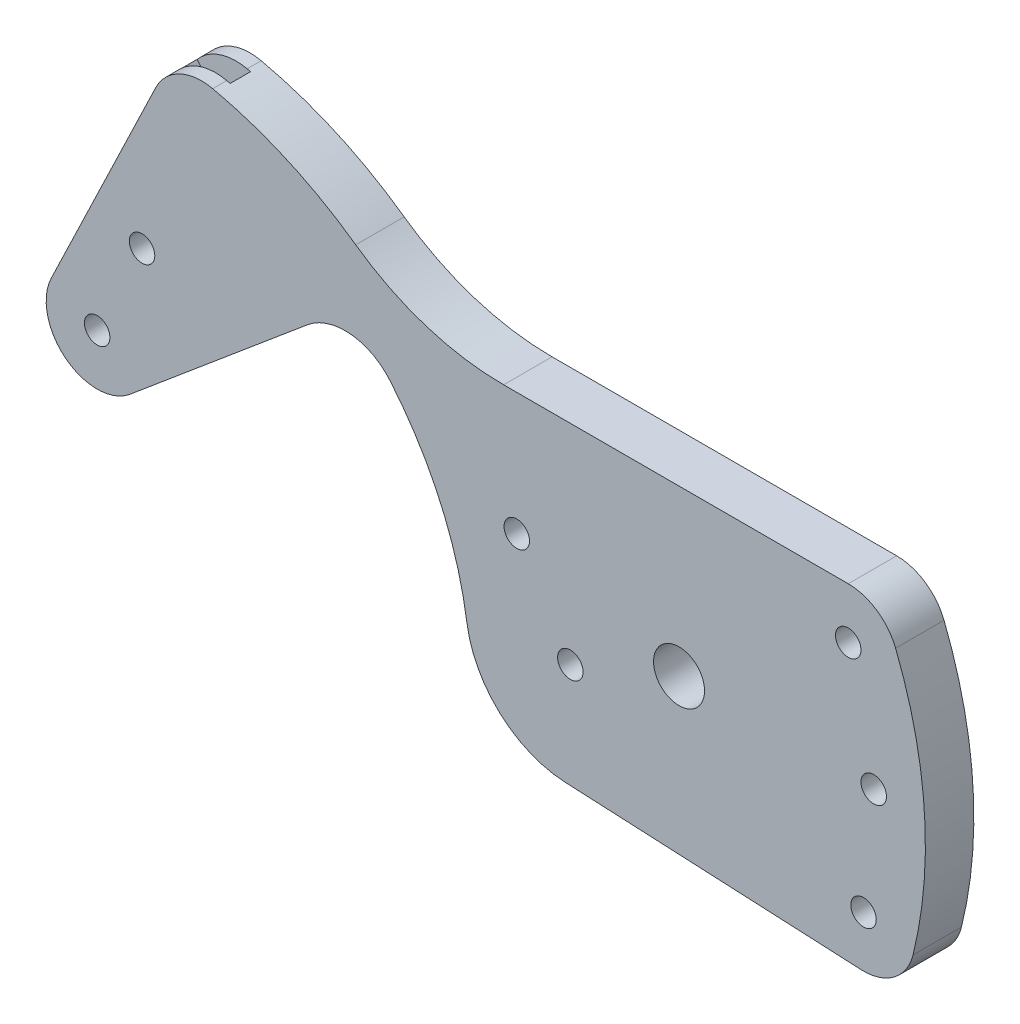
from build123d import *

# Parameters (mm, degrees)
SKETCH1_R           = 2.5
SKETCH1_R_2         = 5
BOSS_EXTRUDE1_DEPTH = 4.75
CUT_EXTRUDE1_DEPTH  = 2


with BuildPart() as part:
    # Sketch1 → Boss-Extrude1 (new, symmetric)
    with BuildSketch(Plane.XY):
        with BuildLine():
            Line((-22.308767332, -29.181670657), (35.698943118, -31.988315456))
            ThreePointArc((35.698943118, -31.988315456), (42.1516901, -30.02280497), (45.888257007, -24.406823948))
            ThreePointArc((45.888257007, -24.406823948), (48.128157677, 1.060560267), (42.475146865, 25.993435805))
            ThreePointArc((42.475146865, 25.993435805), (38.797626972, 30.574489653), (33.182217728, 32.3))
            Line((33.182217728, 32.3), (-34.397529085, 32.3))
            ThreePointArc((-34.397529085, 32.3), (-49.622555092, 34.67439152), (-63.401574193, 41.572056677))
            ThreePointArc((-63.401574193, 41.572056677), (-76.799263642, 49.225759558), (-91.448521696, 54.071013816))
            ThreePointArc((-91.448521696, 54.071013816), (-97.990041102, 53.309279516), (-102.639296293, 48.644931604))
            Line((-102.639296293, 48.644931604), (-123.129936653, 6.033713582))
            ThreePointArc((-123.129936653, 6.033713582), (-120.252485213, -6.197177966), (-107.689906175, -5.960444431))
            Line((-107.689906175, -5.960444431), (-72.864818345, 23.261273923))
            ThreePointArc((-72.864818345, 23.261273923), (-64.470178387, 25.908093735), (-56.662687309, 21.843771132))
            ThreePointArc((-56.662687309, 21.843771132), (-46.805355693, 6.125218695), (-41.605017691, -11.684788659))
            ThreePointArc((-41.605017691, -11.684788659), (-35.091884298, -23.890622031), (-22.308767332, -29.181670657))
        make_face()
        with Locations((36.182217728, -22)):
            Circle(SKETCH1_R, mode=Mode.SUBTRACT)
        with Locations((-21.317782272, -8.7)):
            Circle(SKETCH1_R, mode=Mode.SUBTRACT)
        Circle(SKETCH1_R_2, mode=Mode.SUBTRACT)
        with Locations((-31.817782272, 8.3)):
            Circle(SKETCH1_R, mode=Mode.SUBTRACT)
        with Locations((38.182217728, -0.1)):
            Circle(SKETCH1_R, mode=Mode.SUBTRACT)
        with Locations((33.182217728, 22.3)):
            Circle(SKETCH1_R, mode=Mode.SUBTRACT)
        with Locations((-105.317782272, 20)):
            Circle(SKETCH1_R, mode=Mode.SUBTRACT)
        with Locations((-114.117782272, 1.7)):
            Circle(SKETCH1_R, mode=Mode.SUBTRACT)
    extrude(amount=BOSS_EXTRUDE1_DEPTH, both=True)

    # Sketch2 → Cut-Extrude1 (cut, symmetric)
    with BuildSketch(Plane.XY):
        with BuildLine():
            Line((-73.85662622, 22.429048301), (-91.565791976, 44.926021843))
            Line((-91.565791976, 44.926021843), (-90.764156613, 54.099134816))
            Line((-90.764156613, 54.099134816), (-92.756563124, 54.273250574))
            ThreePointArc((-92.756563124, 54.273250574), (-96.485258205, 53.894076221), (-99.812475399, 52.168803507))
            Line((-99.812475399, 52.168803507), (-101.383992496, 50.931736809))
            Line((-101.383992496, 50.931736809), (-95.688491848, 43.696414201))
            Line((-95.688491848, 43.696414201), (-99.421691631, 0.977411343))
            Line((-99.421691631, 0.977411343), (-73.85662622, 22.429048301))
        make_face()
    extrude(amount=CUT_EXTRUDE1_DEPTH, both=True, mode=Mode.SUBTRACT)


solid = part.part
